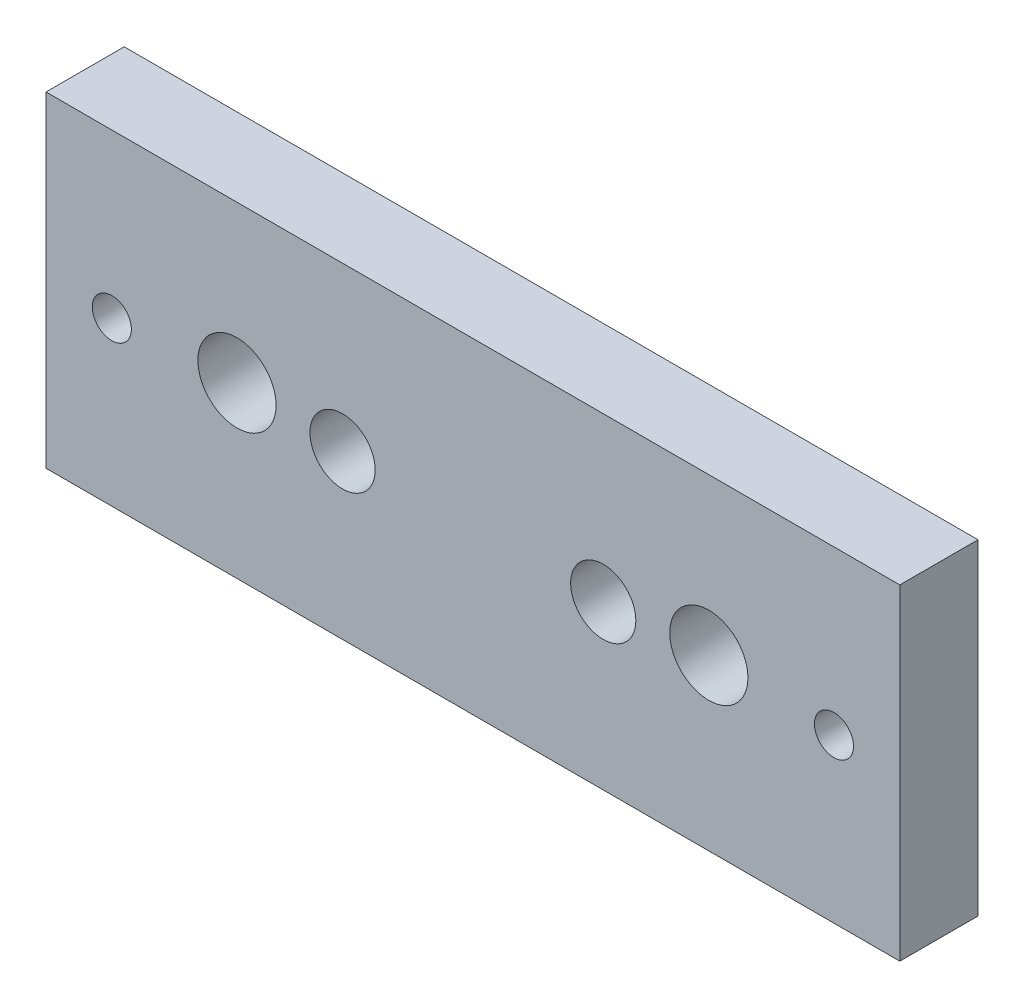
from build123d import *

# Parameters (mm, degrees)
SKETCH1_W             = 65.5
SKETCH1_H             = 25
BOSS_EXTRUDE1_DEPTH   = 6
F_5_0MM_DOWEL_HOLE1_D = 5
SKETCH4_R             = 3
CUT_EXTRUDE1_DEPTH    = 71.3651192
F_3_0MM_DOWEL_HOLE1_D = 3


with BuildPart() as part:
    # Sketch1 → Boss-Extrude1 (new body)
    with BuildSketch(Plane.XY):
        with Locations((32.75, 12.5)):
            Rectangle(SKETCH1_W, SKETCH1_H)
    extrude(amount=BOSS_EXTRUDE1_DEPTH)

    # Ø5.0mm Dowel Hole1 (through all)
    with Locations(Plane.XY.offset(6)):
        with Locations((22.75, 12.5), (42.75, 12.5)):
            Hole(F_5_0MM_DOWEL_HOLE1_D / 2)

    # Sketch4 → Cut-Extrude1 (cut, through all)
    with BuildSketch(Plane.XY.offset(6)):
        with Locations((14.65, 13)):
            Circle(SKETCH4_R)
        with Locations((50.85, 13)):
            Circle(SKETCH4_R)
    extrude(amount=-CUT_EXTRUDE1_DEPTH, mode=Mode.SUBTRACT)

    # Ø3.0mm Dowel Hole1 (through all)
    with Locations(Plane.XY.offset(6)):
        with Locations((5.05, 12.5), (60.45, 12.5)):
            Hole(F_3_0MM_DOWEL_HOLE1_D / 2)


solid = part.part
